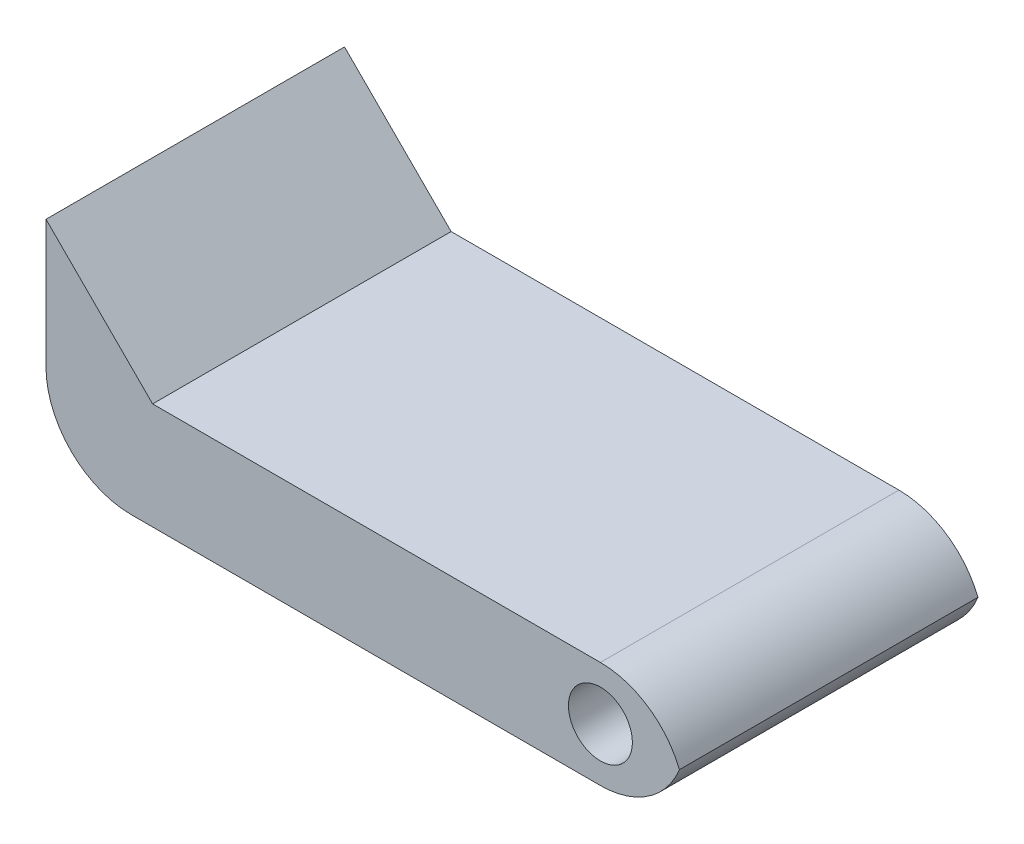
from build123d import *

# Parameters (mm, degrees)
BOSS_EXTRUDE1_DEPTH = 17.78
FILLET2_R           = 5.08
SKETCH3_R           = 1.905
CUT_EXTRUDE1_DEPTH  = 43.521299369


with BuildPart() as part:
    # Sketch1 → Boss-Extrude1 (new body)
    with BuildSketch(Plane(origin=(0, 0, 0), x_dir=(0, 1, 0), z_dir=(0, 0, 1))):
        Polygon((0, 0), (0, 31.75), (6.35, 38.1), (-6.35, 38.1), (-6.35, 0), align=None)
    extrude(amount=BOSS_EXTRUDE1_DEPTH)

    # Fillet2
    # the kernel refuses this fillet: 5.08 mm, written as the material it takes off along each edge
    with BuildSketch(Plane(origin=(-38.1, -6.35, -12.7), x_dir=(0, 1, 0), z_dir=(0, 0, 1)), Plane(origin=(0, -6.35, -12.7), x_dir=(-1, 0, 0), z_dir=(0, 0, 1))) as fillet2_piece_1:
        with BuildLine():
            CenterArc((FILLET2_R, -FILLET2_R), FILLET2_R, 90, 90)
            Line((0, -FILLET2_R), (0, 0))
            Line((0, 0), (FILLET2_R, 0))
        make_face()
    extrude(amount=43.18, mode=Mode.SUBTRACT)
    with BuildSketch(Plane(origin=(0, 0, -12.7), x_dir=(-1, 0, 0), z_dir=(0, 0, 1))) as fillet2_piece_2:
        with BuildLine():
            CenterArc((FILLET2_R, FILLET2_R), FILLET2_R, 180, 90)
            Line((0, FILLET2_R), (0, 0))
            Line((0, 0), (FILLET2_R, 0))
        make_face()
    extrude(amount=43.18, mode=Mode.SUBTRACT)

    # Sketch3 → Cut-Extrude1 (cut, through all)
    with BuildSketch(Plane.XY.offset(17.78)):
        with Locations((-5.08, -3.175)):
            Circle(SKETCH3_R)
    extrude(amount=-CUT_EXTRUDE1_DEPTH, mode=Mode.SUBTRACT)


solid = part.part
